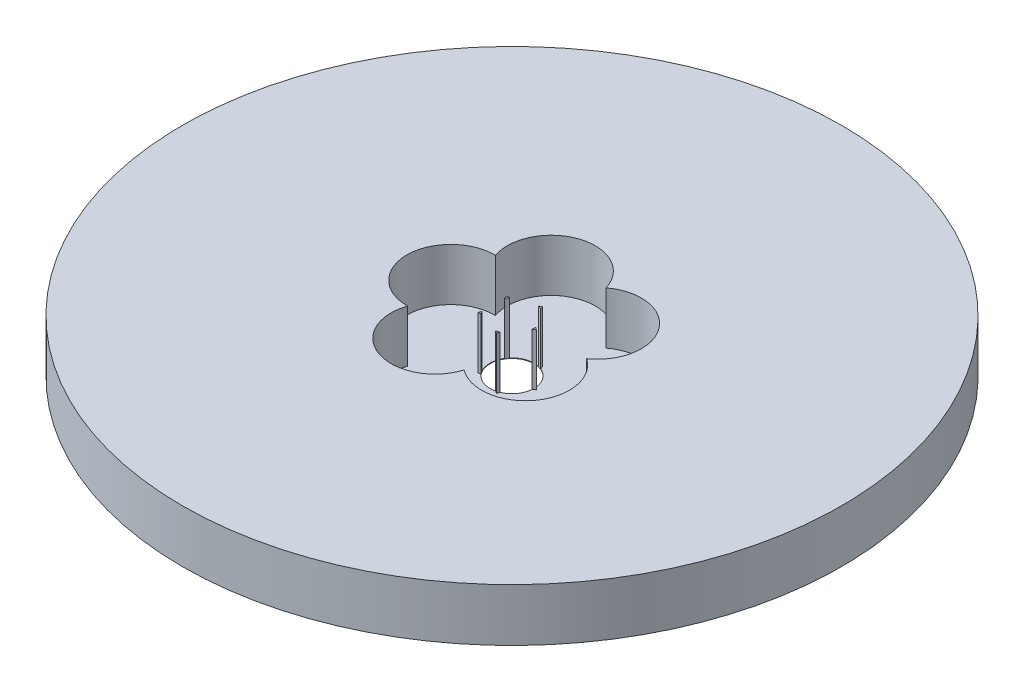
from build123d import *

# Parameters (mm, degrees)
SKETCH1_R           = 75
BOSS_EXTRUDE1_DEPTH = 12
SKETCH2_R           = 5
CUT_EXTRUDE1_DEPTH  = 107.742681248
SKETCH3_R           = 10
CUT_EXTRUDE2_DEPTH  = 11.87311686
CIRPATTERN1_COUNT   = 5


with BuildPart() as part:
    # Sketch1 → Boss-Extrude1 (new body)
    with BuildSketch(Plane(origin=(0, 0, 0), x_dir=(1, 0, 0), z_dir=(0, 1, 0))):
        Circle(SKETCH1_R)
    extrude(amount=BOSS_EXTRUDE1_DEPTH)

    # Sketch2 → Cut-Extrude1 (cut, through all)
    with BuildSketch(Plane(origin=(0, 0, 0), x_dir=(1, 0, 0), z_dir=(0, 1, 0))):
        Circle(SKETCH2_R)
    extrude(amount=CUT_EXTRUDE1_DEPTH, mode=Mode.SUBTRACT)

    # Sketch3 → Cut-Extrude2 (cut)
    with BuildSketch(Plane(origin=(0, 12, 0), x_dir=(1, 0, 0), z_dir=(0, 1, 0))):
        with Locations((-13.924696634, 0)):
            Circle(SKETCH3_R)
    cut_extrude2 = extrude(amount=-CUT_EXTRUDE2_DEPTH, mode=Mode.SUBTRACT)

    # CirPattern1: Cut-Extrude2 ×5 about axis
    cirpattern1_axis = Axis((0, 0, 0), (0, 1, 0))
    for i in range(1, CIRPATTERN1_COUNT):
        add(cut_extrude2.rotate(cirpattern1_axis, i * 360 / CIRPATTERN1_COUNT), mode=Mode.SUBTRACT)


solid = part.part
